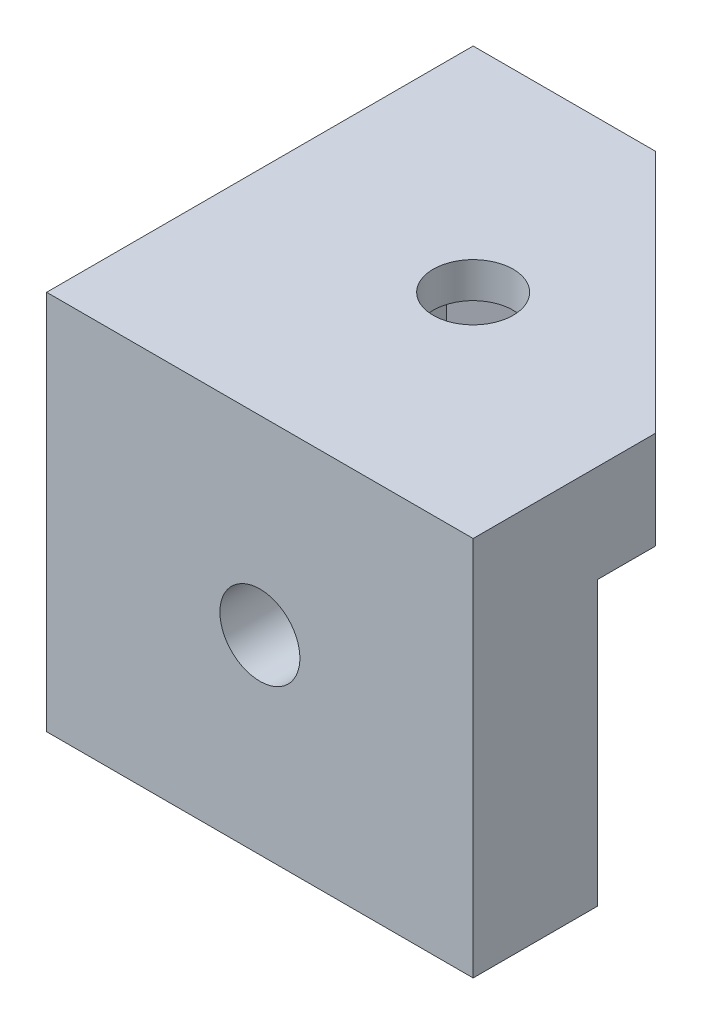
from build123d import *

# Parameters (mm, degrees)
SKETCH1_W                    = 38.1
SKETCH1_H                    = 38.1
MAIN_BODY_DEPTH              = 34
F_9_32_RIGHT_RAIL_DEPTH      = 64.712008287
F_9_32_RIGHT_RAIL_DEPTH_BACK = 5.55625
SKETCH3_R                    = 3.571875
SKETCH4_R                    = 3.571875
F_9_32_LEFT_RAIL_DEPTH       = 5.55625
F_9_32_TOPPER_DEPTH          = 64.712008287
F_9_32_TOPPER_DEPTH_BACK     = 10
SKETCH8_R                    = 3.571875
HEX_START                    = -5.55625
HEX_HOLE_RIGHT_DEPTH         = 32.54375
HEX_HOLE_LEFT_DEPTH          = 32.54375
INNER_START                  = -34
INNER_CAVITY_OUTLINE_W       = 26.9875
INNER_CAVITY_OUTLINE_H       = 26.9875
INNER_CAVITY_DEPTH           = 25.26875
HEX_START_2                  = -17
HEX_HOLE_TOP_DEPTH           = 13.825
TOP_CORNER_REACH             = 65.712


# Read off the part's stored shape, not the designer's step: Inner Cavity
with BuildPart() as part:
    # Sketch1 → Main Body (new body)
    with BuildSketch(Plane(origin=(0, 0, 0), x_dir=(1, 0, 0), z_dir=(0, 1, 0))):
        with Locations((19.05, 19.05)):
            Rectangle(SKETCH1_W, SKETCH1_H)
    extrude(amount=MAIN_BODY_DEPTH)

    # Sketch3 → 9/32 Right Rail (cut, two sides: drawn at the far end of the back side and taken through both)
    with BuildSketch(Plane.XY.offset(-F_9_32_RIGHT_RAIL_DEPTH_BACK)):
        with Locations(Location((19.05, 17, 0), (0, 0, 180))):
            Circle(SKETCH3_R)
    extrude(amount=F_9_32_RIGHT_RAIL_DEPTH + F_9_32_RIGHT_RAIL_DEPTH_BACK, mode=Mode.SUBTRACT)

    # Sketch4 → 9/32 Left Rail (cut)
    with BuildSketch(Plane.ZY):
        with Locations((-19.05, 17)):
            Circle(SKETCH4_R)
    extrude(amount=-F_9_32_LEFT_RAIL_DEPTH, mode=Mode.SUBTRACT)

    # Sketch8 → 9/32 Topper (cut, two sides: drawn at the far end of the back side and taken through both)
    with BuildSketch(Plane(origin=(0, 34, 0), x_dir=(1, 0, 0), z_dir=(0, 1, 0)).offset(-F_9_32_TOPPER_DEPTH_BACK)):
        with Locations(Location((19.05, 19.05, 0), (0, 0, 90))):
            Circle(SKETCH8_R)
    extrude(amount=F_9_32_TOPPER_DEPTH + F_9_32_TOPPER_DEPTH_BACK, mode=Mode.SUBTRACT)

    # Sketch9 → Hex Hole Right (cut)
    with BuildSketch(Plane.ZY.offset(HEX_START)):
        Polygon((-22.315182739, 22.6554624), (-25.580365478, 17), (-22.315182739, 11.3445376), (-15.784817261, 11.3445376), (-12.519634522, 17), (-15.784817261, 22.6554624), align=None)
    extrude(amount=-HEX_HOLE_RIGHT_DEPTH, mode=Mode.SUBTRACT)

    # Sketch10 → Hex Hole Left (cut)
    with BuildSketch(Plane.XY.offset(HEX_START)):
        Polygon((15.784813595, 22.65546875), (12.51962719, 17), (15.784813595, 11.34453125), (22.315186405, 11.34453125), (25.58037281, 17), (22.315186405, 22.65546875), align=None)
    extrude(amount=-HEX_HOLE_LEFT_DEPTH, mode=Mode.SUBTRACT)

    # Inner Cavity outline → Inner Cavity (cut)
    with BuildSketch(Plane(origin=(0, 34, 0), x_dir=(1, 0, 0), z_dir=(0, 1, 0)).offset(INNER_START)):
        with Locations((24.60625, 24.60625)):
            Rectangle(INNER_CAVITY_OUTLINE_W, INNER_CAVITY_OUTLINE_H)
    extrude(amount=INNER_CAVITY_DEPTH, mode=Mode.SUBTRACT)

    # Sketch14 → Hex Hole Top (cut)
    with BuildSketch(Plane(origin=(0, 34, 0), x_dir=(1, 0, 0), z_dir=(0, 1, 0)).offset(HEX_START_2)):
        Polygon((24.70546875, 22.315186405), (19.05, 25.58037281), (13.39453125, 22.315186405), (13.39453125, 15.784813595), (19.05, 12.51962719), (24.70546875, 15.784813595), align=None)
    extrude(amount=HEX_HOLE_TOP_DEPTH, mode=Mode.SUBTRACT)

    # Sketch16 → Top Corner (cut, up to next)
    with BuildSketch(Plane(origin=(0, 34, 0), x_dir=(1, 0, 0), z_dir=(0, 1, 0)), mode=Mode.PRIVATE) as top_corner_sk1:
        Polygon((38.1, 38.1), (16.276714219, 38.1), (38.1, 16.276714219), align=None)
    top_corner_tool1 = extrude(top_corner_sk1.sketch, amount=-TOP_CORNER_REACH, mode=Mode.PRIVATE) & part.part
    add(top_corner_tool1.solids().sort_by_distance((30.825571, 34, -30.825571))[0], mode=Mode.SUBTRACT)


solid = part.part
